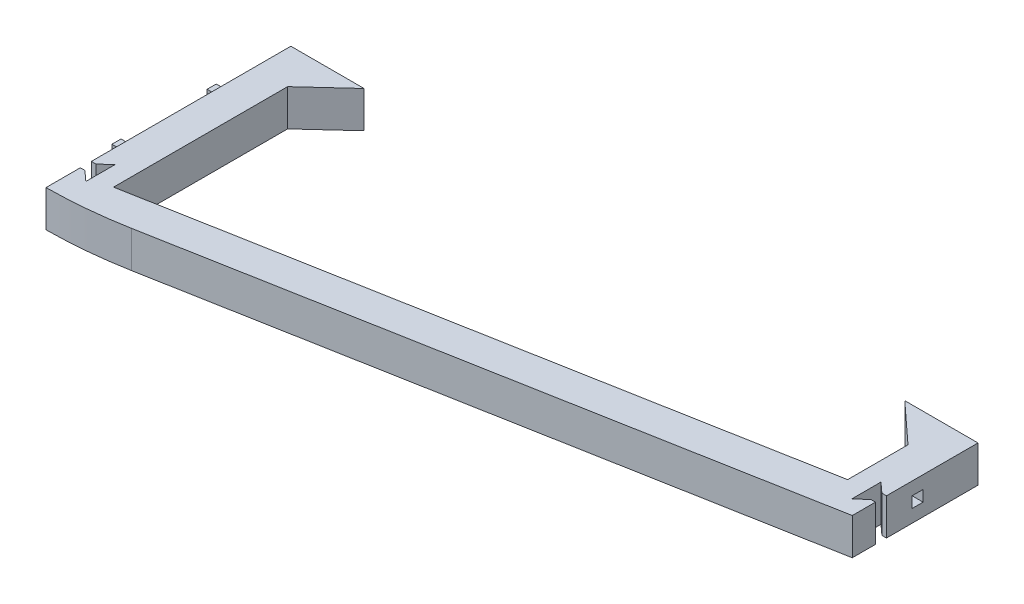
from build123d import *

# Parameters (mm, degrees)
P_IDAT_VYSUNUT_M1_DEPTH  = 8
ODEBRAT_VYSUNUT_M1_DEPTH = 161.106285011
SKICA3_W                 = 2
SKICA3_H                 = 2
P_IDAT_VYSUNUT_M2_DEPTH  = 4
SKICA5_W                 = 16
SKICA5_H                 = 8
P_IDAT_VYSUNUT_M3_DEPTH  = 8
ODEBRAT_VYSUNUT_M4_DEPTH = 161.106285011
SKICA4_W                 = 2.4
SKICA4_H                 = 2.4
ODEBRAT_VYSUNUT_M2_DEPTH = 4.4
ODEBRAT_VYSUNUT_M5_DEPTH = 161.106285011
ODEBRAT_VYSUNUT_M6_DEPTH = 161.106285011
ZAOBLIT1_R               = 100
SKICA11_R                = 2.2
ODEBRAT_VYSUNUT_M7_DEPTH = 2.4
SKICA12_R                = 1.85
ODEBRAT_VYSUNUT_M8_DEPTH = 7


with BuildPart() as part:
    # Skica1 → Přidat vysunutím1 (new body)
    with BuildSketch(Plane(origin=(0, 0, 0), x_dir=(1, 0, 0), z_dir=(0, 1, 0))):
        Polygon((0, 0), (0, -55), (150.15, -27.472114866), (150.15, 0), (142.85, 0), (142.85, -21.185463454), (7.3, -46.036644473), (7.3, 0), align=None)
    extrude(amount=P_IDAT_VYSUNUT_M1_DEPTH)

    # Skica2 → Odebrat vysunutím1 (cut, through all)
    with BuildSketch(Plane(origin=(0, 8, 0), x_dir=(1, 0, 0), z_dir=(0, 1, 0))):
        Polygon((0, -43.6), (1, -43.6), (3.2, -41.6), (3.2, -48), (1, -46), (0, -46), align=None)
    extrude(amount=-ODEBRAT_VYSUNUT_M1_DEPTH, mode=Mode.SUBTRACT)

    # Skica3 → Přidat vysunutím2 (add)
    with BuildSketch(Plane.ZY):
        with Locations((13.3, 4)):
            Rectangle(SKICA3_W, SKICA3_H)
        with Locations((34.1, 4)):
            Rectangle(SKICA3_W, SKICA3_H)
    extrude(amount=P_IDAT_VYSUNUT_M2_DEPTH)

    # Skica5 → Přidat vysunutím3 (add)
    with BuildSketch(Plane(origin=(0, 8, 0), x_dir=(1, 0, 0), z_dir=(0, 1, 0))):
        with Locations((8, -4)):
            Rectangle(SKICA5_W, SKICA5_H)
        with Locations((142.15, -4)):
            Rectangle(SKICA5_W, SKICA5_H)
    extrude(amount=-P_IDAT_VYSUNUT_M3_DEPTH)

    # Skica7 → Odebrat vysunutím4 (cut, through all)
    with BuildSketch(Plane.XZ):
        Polygon((7.3, 8), (16, 0), (16, 8), align=None)
        Polygon((134.15, 0), (134.15, 8), (142.85, 8), align=None)
    extrude(amount=-ODEBRAT_VYSUNUT_M4_DEPTH, mode=Mode.SUBTRACT)

    # Skica4 → Odebrat vysunutím2 (cut)
    with BuildSketch(Plane(origin=(150.15, 0, 0), x_dir=(0, 0, -1), z_dir=(1, 0, 0))):
        with Locations((-13.2, 4)):
            Rectangle(SKICA4_W, SKICA4_H)
    extrude(amount=-ODEBRAT_VYSUNUT_M2_DEPTH, mode=Mode.SUBTRACT)

    # Skica8 → Odebrat vysunutím5 (cut, through all)
    with BuildSketch(Plane(origin=(0, 8, 0), x_dir=(1, 0, 0), z_dir=(0, 1, 0))):
        Polygon((150.15, -20), (149.15, -20), (146.95, -18), (146.95, -24.4), (149.15, -22.4), (150.15, -22.4), align=None)
    extrude(amount=-ODEBRAT_VYSUNUT_M5_DEPTH, mode=Mode.SUBTRACT)

    # Skica9 → Odebrat vysunutím6 (cut, through all)
    with BuildSketch(Plane(origin=(0, 8, 0), x_dir=(1, 0, 0), z_dir=(0, 1, 0))):
        Polygon((0, -53.5), (8.181703712, -53.5), (0, -55), align=None)
    extrude(amount=-ODEBRAT_VYSUNUT_M6_DEPTH, mode=Mode.SUBTRACT)

    # Zaoblit1
    # the kernel refuses this fillet: 100 mm, written as the material it takes off along each edge
    with BuildSketch(Plane(origin=(8.181703712, 30.667234564, 53.5), x_dir=(0.9836061098745081, 0, -0.18033030975833525), z_dir=(0, -1, 0))) as zaoblit1_piece_1:
        with BuildLine():
            CenterArc((9.066893825, -100), ZAOBLIT1_R, 90, 9.854379591)
            Line((-8.047573761, -1.475409165), (-8.389863112, 0.495082652))
            ThreePointArc((-8.389863112, 0.495082652), (-4.3844475, 1.229507637), (-0.36066062, 1.96721222))
            Line((-0.36066062, 1.96721222), (0, 2))
            Line((0, 2), (9.066893825, 2))
            Line((9.066893825, 2), (9.066893825, 0))
        make_face()
    extrude(amount=53.334469127, mode=Mode.SUBTRACT)

    # Skica11 → Odebrat vysunutím7 (cut)
    with BuildSketch(Plane(origin=(0, 0, 0), x_dir=(-1, 0, 0), z_dir=(0, 0, -1))):
        with Locations((-146.5, 4)):
            Circle(SKICA11_R)
        with Locations((-3.65, 4)):
            Circle(SKICA11_R)
    extrude(amount=-ODEBRAT_VYSUNUT_M7_DEPTH, mode=Mode.SUBTRACT)

    # Skica12 → Odebrat vysunutím8 (cut)
    with BuildSketch(Plane(origin=(0, 0, 2.4), x_dir=(-1, 0, 0), z_dir=(0, 0, -1))):
        with Locations((-146.5, 4)):
            Circle(SKICA12_R)
        with Locations((-3.65, 4)):
            Circle(SKICA12_R)
    extrude(amount=-ODEBRAT_VYSUNUT_M8_DEPTH, mode=Mode.SUBTRACT)


solid = part.part
